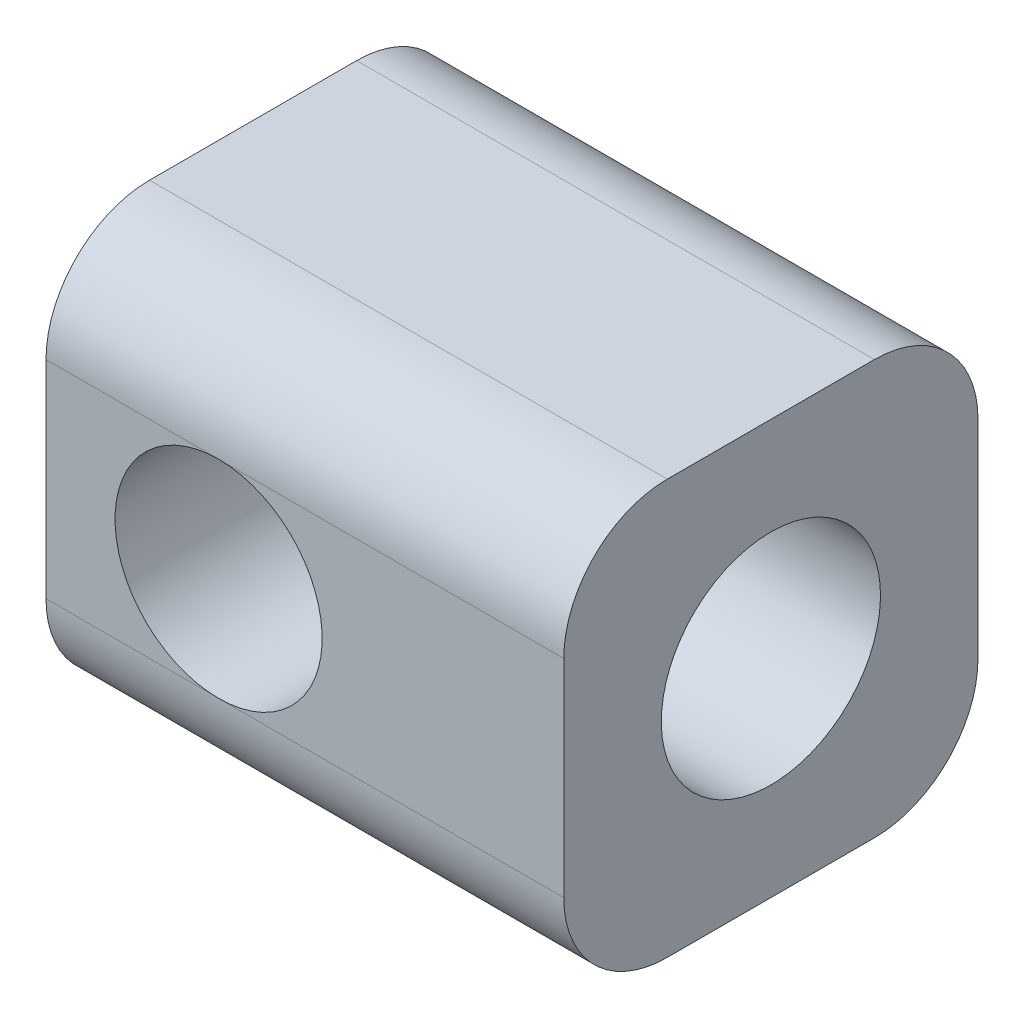
from build123d import *

# Parameters (mm, degrees)
SKETCH1_W           = 15
SKETCH1_H           = 12
SKETCH1_R           = 3
BOSS_EXTRUDE1_DEPTH = 12
SKETCH2_R           = 3.175
CUT_EXTRUDE1_DEPTH  = 10
FILLET1_R           = 3


with BuildPart() as part:
    # Sketch1 → Boss-Extrude1 (new body)
    with BuildSketch(Plane.XY):
        with Locations((2.5, 0)):
            Rectangle(SKETCH1_W, SKETCH1_H)
        Circle(SKETCH1_R, mode=Mode.SUBTRACT)
    extrude(amount=BOSS_EXTRUDE1_DEPTH)

    # Sketch2 → Cut-Extrude1 (cut)
    with BuildSketch(Plane(origin=(10, 0, 0), x_dir=(0, 0, -1), z_dir=(1, 0, 0))):
        with Locations(Location((-6, 0, 0), (0, 0, 90))):
            Circle(SKETCH2_R)
    extrude(amount=-CUT_EXTRUDE1_DEPTH, mode=Mode.SUBTRACT)

    # Fillet1
    fillet1_edges = [part.edges().sort_by_distance(p)[0] for p in [
        (2.5, 6, 12),
        (2.5, 6, 0),
        (2.5, -6, 0),
        (2.5, -6, 12),
    ]]
    fillet(fillet1_edges, radius=FILLET1_R - 0.0001)  # a hair under: the kernel refuses the full size


solid = part.part
